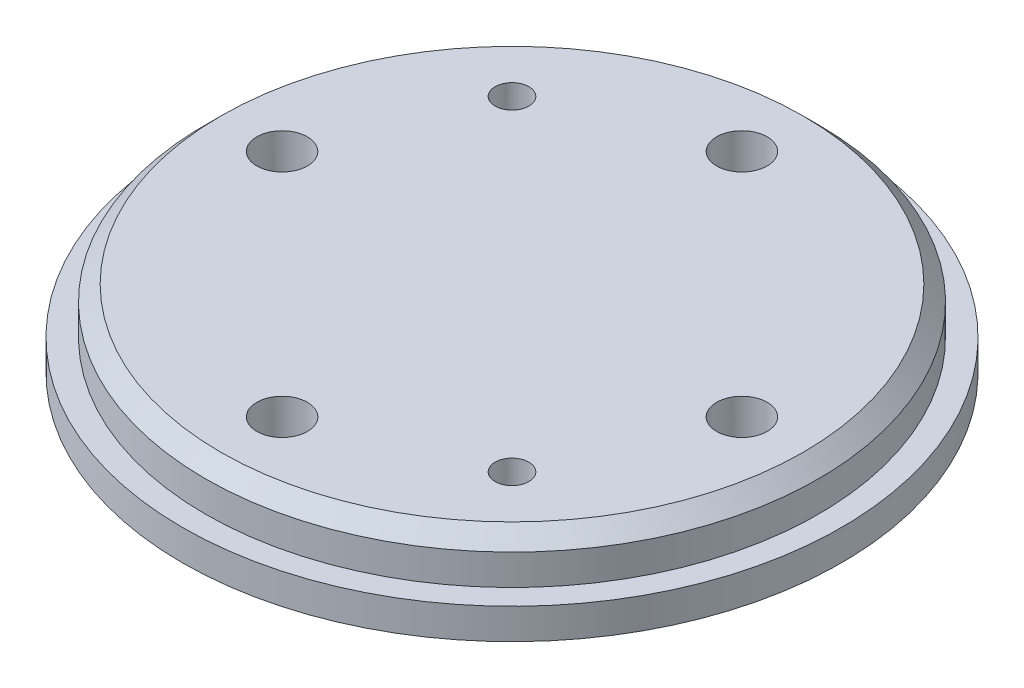
from build123d import *

# Parameters (mm, degrees)
SKETCH_1_R                           = 21.5
EXTRUDE_1_DEPTH                      = 2
SKETCH_3_R                           = 20
EXTRUDE_2_DEPTH                      = 3
CHAMFER_1_SIZE                       = 1
SKETCH_4_R                           = 1.65
CUT_EXTRUDE_1_DEPTH                  = 31.813957876
CHAMFER_2_SIZE                       = 0.5
PATTERN_CIRCULAR_1_COUNT             = 4
CHAMFER_2_OF_PATTERN_CIRCULAR_1_SIZE = 0.5
SKETCH_5_R                           = 1.1
CUT_EXTRUDE_2_DEPTH                  = 31.813957876
SKETCH_6_R                           = 2.1
CUT_EXTRUDE_3_DEPTH                  = 2
CHAMFER_3_SIZE                       = 1
PATTERN_CIRCULAR_2_COUNT             = 2
CHAMFER_3_OF_PATTERN_CIRCULAR_2_SIZE = 1


with BuildPart() as part:
    # 草图1 → 凸台-拉伸1 (new body)
    with BuildSketch(Plane(origin=(0, 0, 0), x_dir=(1, 0, 0), z_dir=(0, 1, 0))):
        with Locations(Location((0, 0, 0), (0, 0, 270))):
            Circle(SKETCH_1_R)
    extrude(amount=EXTRUDE_1_DEPTH)

    # 草图3 → 凸台-拉伸2 (add)
    with BuildSketch(Plane(origin=(0, 2, 0), x_dir=(1, 0, 0), z_dir=(0, 1, 0))):
        with Locations(Location((0, 0, 0), (0, 0, 270))):
            Circle(SKETCH_3_R)
    extrude(amount=EXTRUDE_2_DEPTH)

    # 倒角1
    chamfer_1_edges = [part.edges().sort_by_distance(p)[0] for p in [
        (0, 5, -20),
    ]]
    chamfer(chamfer_1_edges, length=CHAMFER_1_SIZE)

    # 草图4 → 切除-拉伸1 (cut, through all)
    with BuildSketch(Plane(origin=(0, 5, 0), x_dir=(1, 0, 0), z_dir=(0, 1, 0))):
        with Locations(Location((0, 15, 0), (0, 0, 270))):
            Circle(SKETCH_4_R)
    cut_extrude_1 = extrude(amount=-CUT_EXTRUDE_1_DEPTH, mode=Mode.SUBTRACT)

    # 倒角2
    chamfer_2_edges = [part.edges().sort_by_distance(p)[0] for p in [
        (0, 0, -16.65),
    ]]
    chamfer(chamfer_2_edges, length=CHAMFER_2_SIZE)

    # 阵列(圆周)1: 切除-拉伸1 ×4 about axis
    pattern_circular_1_axis = Axis((0, 0, 0), (0, 1, 0))
    for i in range(1, PATTERN_CIRCULAR_1_COUNT):
        add(cut_extrude_1.rotate(pattern_circular_1_axis, i * 360 / PATTERN_CIRCULAR_1_COUNT), mode=Mode.SUBTRACT)

    # 倒角2 of 阵列(圆周)1
    chamfer_2_of_pattern_circular_1_edges = [part.edges().sort_by_distance(p)[0] for p in [
        (-16.65, 0, 0),
        (0, 0, 16.65),
        (16.65, 0, 0),
    ]]
    chamfer(chamfer_2_of_pattern_circular_1_edges, length=CHAMFER_2_OF_PATTERN_CIRCULAR_1_SIZE)

    # 草图5 → 切除-拉伸2 (cut, through all)
    with BuildSketch(Plane(origin=(0, 5, 0), x_dir=(1, 0, 0), z_dir=(0, 1, 0))):
        with Locations(Location((-10.606601718, 10.606601718, 0), (0, 0, 270))):
            Circle(SKETCH_5_R)
    cut_extrude_2 = extrude(amount=-CUT_EXTRUDE_2_DEPTH, mode=Mode.SUBTRACT)

    # 草图6 → 切除-拉伸3 (cut)
    with BuildSketch(Plane.XZ):
        with Locations(Location((-10.606601718, -10.606601718, 0), (0, 0, 270))):
            Circle(SKETCH_6_R)
    cut_extrude_3 = extrude(amount=-CUT_EXTRUDE_3_DEPTH, mode=Mode.SUBTRACT)

    # 倒角3
    chamfer_3_edges = [part.edges().sort_by_distance(p)[0] for p in [
        (-10.606601718, 2, -11.706601718),
    ]]
    chamfer(chamfer_3_edges, length=CHAMFER_3_SIZE - 0.0001)  # a hair under: the kernel refuses the full size

    # 阵列(圆周)2: 切除-拉伸2, 切除-拉伸3 ×2 about axis
    pattern_circular_2_axis = Axis((0, 0, 0), (0, 1, 0))
    add([cut_extrude_2.rotate(pattern_circular_2_axis, i * 360 / PATTERN_CIRCULAR_2_COUNT) for i in range(1, PATTERN_CIRCULAR_2_COUNT)], mode=Mode.SUBTRACT)
    add([cut_extrude_3.rotate(pattern_circular_2_axis, i * 360 / PATTERN_CIRCULAR_2_COUNT) for i in range(1, PATTERN_CIRCULAR_2_COUNT)], mode=Mode.SUBTRACT)

    # 倒角3 of 阵列(圆周)2
    chamfer_3_of_pattern_circular_2_edges = [part.edges().sort_by_distance(p)[0] for p in [
        (10.606601718, 2, 11.706601718),
    ]]
    chamfer(chamfer_3_of_pattern_circular_2_edges, length=CHAMFER_3_OF_PATTERN_CIRCULAR_2_SIZE - 0.0001)  # a hair under: the kernel refuses the full size


solid = part.part
